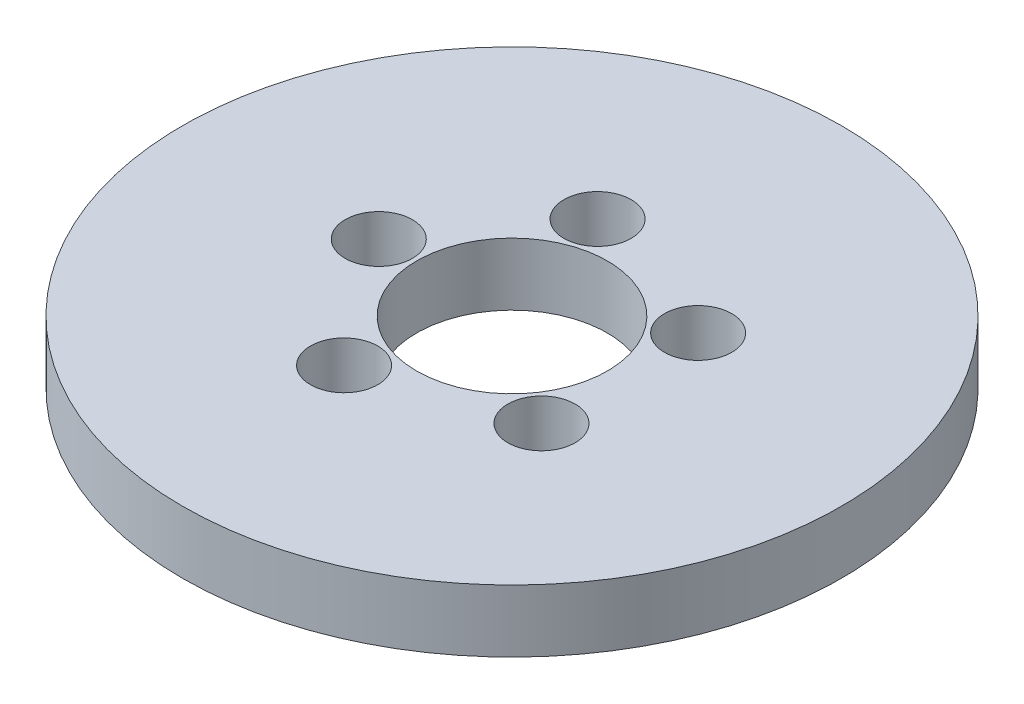
from build123d import *

# Parameters (mm, degrees)
SKETCH1_R           = 95
BOSS_EXTRUDE1_DEPTH = 18
SKETCH2_R           = 27.5
CUT_EXTRUDE1_DEPTH  = 136.550728512
SKETCH3_R           = 9.690952838
CUT_EXTRUDE2_DEPTH  = 17.077067561
CIRPATTERN1_COUNT   = 5


with BuildPart() as part:
    # Sketch1 → Boss-Extrude1 (new body)
    with BuildSketch(Plane(origin=(0, 0, 0), x_dir=(1, 0, 0), z_dir=(0, 1, 0))):
        Circle(SKETCH1_R)
    extrude(amount=BOSS_EXTRUDE1_DEPTH)

    # Sketch2 → Cut-Extrude1 (cut, through all)
    with BuildSketch(Plane(origin=(0, 0, 0), x_dir=(1, 0, 0), z_dir=(0, 1, 0))):
        Circle(SKETCH2_R)
    extrude(amount=CUT_EXTRUDE1_DEPTH, mode=Mode.SUBTRACT)

    # Sketch3 → Cut-Extrude2 (cut)
    with BuildSketch(Plane(origin=(0, 18, 0), x_dir=(1, 0, 0), z_dir=(0, 1, 0))):
        with Locations((-38.410272881, 0)):
            Circle(SKETCH3_R)
    cut_extrude2 = extrude(amount=-CUT_EXTRUDE2_DEPTH, mode=Mode.SUBTRACT)

    # CirPattern1: Cut-Extrude2 ×5 about axis
    cirpattern1_axis = Axis((0, 0, 0), (0, 1, 0))
    for i in range(1, CIRPATTERN1_COUNT):
        add(cut_extrude2.rotate(cirpattern1_axis, i * 360 / CIRPATTERN1_COUNT), mode=Mode.SUBTRACT)


solid = part.part
